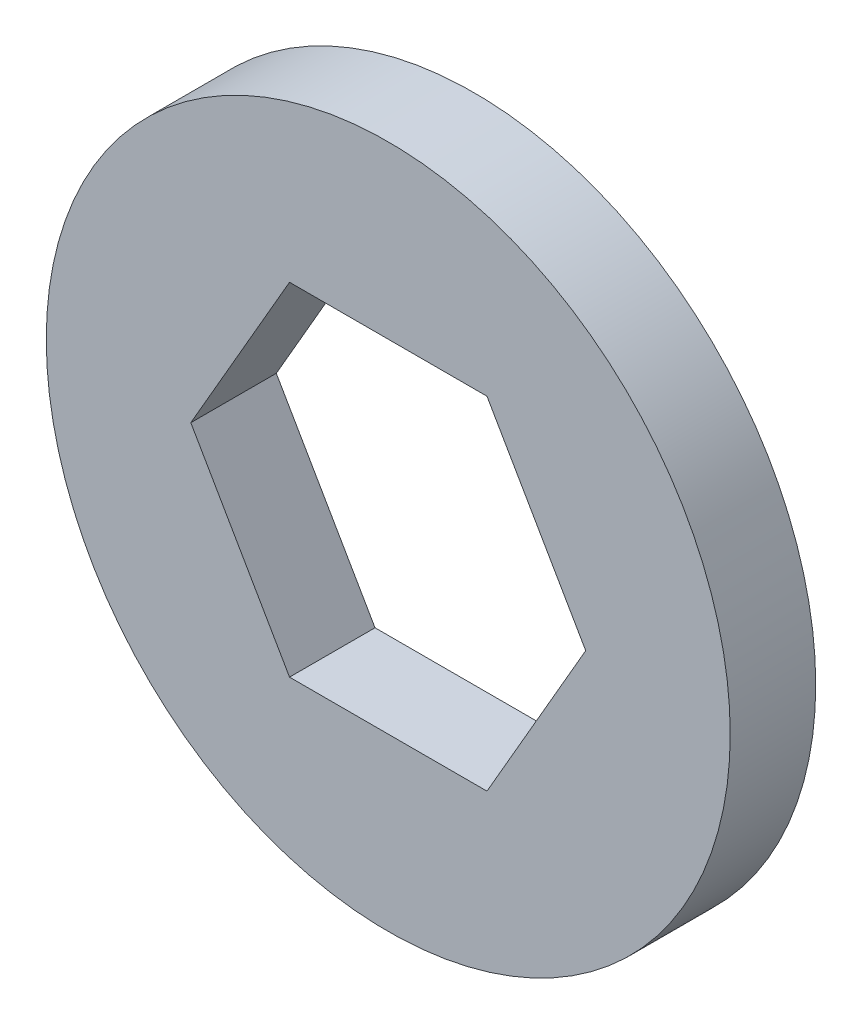
from build123d import *

# Parameters (mm, degrees)
SKETCH1_R           = 12.7
BOSS_EXTRUDE1_DEPTH = 3.175


with BuildPart() as part:
    # Sketch1 → Boss-Extrude1 (new body)
    with BuildSketch(Plane.XY):
        Circle(SKETCH1_R)
        Polygon((-7.332348419, 0), (-3.666174209, -6.35), (3.666174209, -6.35), (7.332348419, 0), (3.666174209, 6.35), (-3.666174209, 6.35), align=None, mode=Mode.SUBTRACT)
    extrude(amount=BOSS_EXTRUDE1_DEPTH)


solid = part.part
